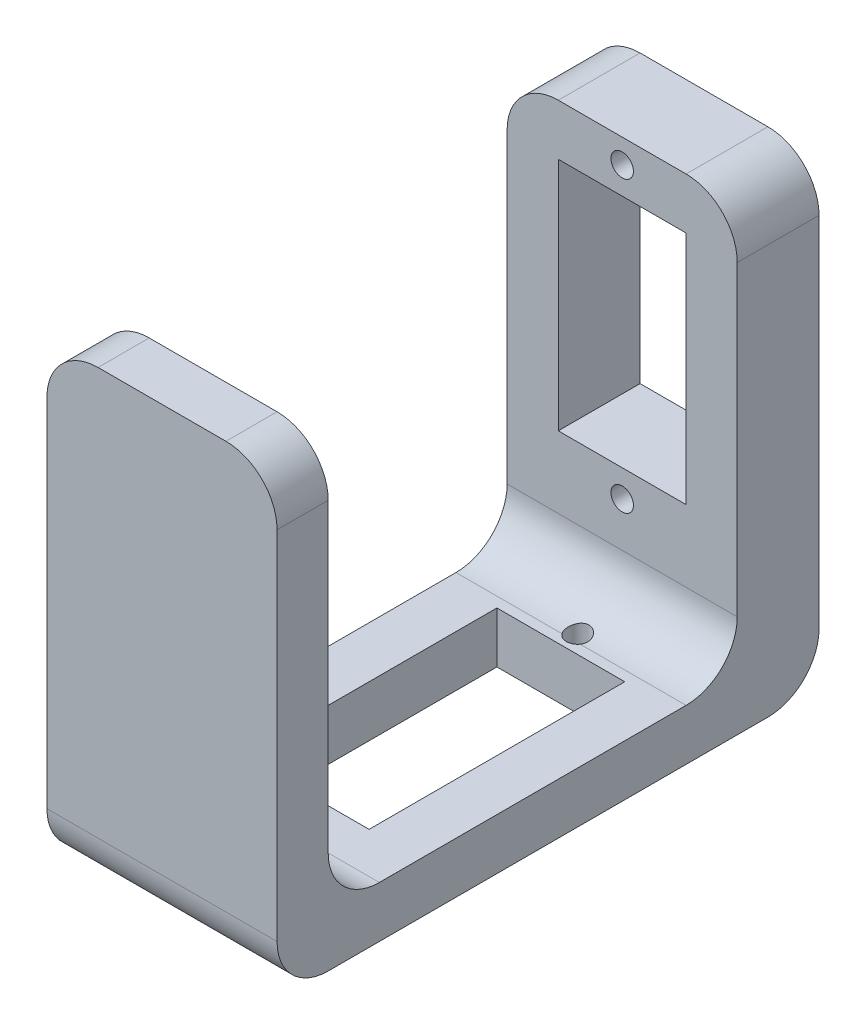
from build123d import *

# Parameters (mm, degrees)
SKETCH1_W           = 22.5
SKETCH1_H           = 33
SKETCH1_W_2         = 12.5
SKETCH1_H_2         = 23
BOSS_EXTRUDE1_DEPTH = 8
SKETCH2_R           = 1.1
CUT_EXTRUDE1_DEPTH  = 22.513077418
SKETCH4_W           = 22.5
SKETCH4_H           = 12
BOSS_EXTRUDE3_DEPTH = 8
SKETCH5_W           = 22.5
SKETCH5_H           = 5
BOSS_EXTRUDE4_DEPTH = 45
SKETCH6_W           = 12.5
SKETCH6_H           = 25
CUT_EXTRUDE2_DEPTH  = 71.431260815
SKETCH7_R           = 1.1
CUT_EXTRUDE3_DEPTH  = 65
FILLET1_R           = 5
SKETCH9_W           = 22.5
SKETCH9_H           = 44.865556073
BOSS_EXTRUDE5_DEPTH = 5
SKETCH10_R          = 8.736478528
CUT_EXTRUDE4_DEPTH  = 3
FILLET2_R           = 5
FILLET3_R           = 5
FILLET4_R           = 5


with BuildPart() as part:
    # Sketch1 → Boss-Extrude1 (new body)
    with BuildSketch(Plane.XY):
        Rectangle(SKETCH1_W, SKETCH1_H)
        Rectangle(SKETCH1_W_2, SKETCH1_H_2, mode=Mode.SUBTRACT)
    extrude(amount=BOSS_EXTRUDE1_DEPTH)

    # Sketch2 → Cut-Extrude1 (cut, through all)
    with BuildSketch(Plane.XY.offset(8)):
        with Locations((0, -14.145204103)):
            Circle(SKETCH2_R)
        with Locations((0, 14.145204103)):
            Circle(SKETCH2_R)
    extrude(amount=-CUT_EXTRUDE1_DEPTH, mode=Mode.SUBTRACT)

    # Sketch4 → Boss-Extrude3 (add)
    with BuildSketch(Plane(origin=(0, 0, 0), x_dir=(-1, 0, 0), z_dir=(0, 0, -1))):
        with Locations((0, -22.5)):
            Rectangle(SKETCH4_W, SKETCH4_H)
    extrude(amount=-BOSS_EXTRUDE3_DEPTH)

    # Sketch5 → Boss-Extrude4 (add)
    with BuildSketch(Plane.XY.offset(8)):
        with Locations((0, -26)):
            Rectangle(SKETCH5_W, SKETCH5_H)
    extrude(amount=BOSS_EXTRUDE4_DEPTH)

    # Sketch6 → Cut-Extrude2 (cut, through all)
    with BuildSketch(Plane.XZ.offset(28.5)):
        with Locations((0, 26.5)):
            Rectangle(SKETCH6_W, SKETCH6_H)
    extrude(amount=-CUT_EXTRUDE2_DEPTH, mode=Mode.SUBTRACT)

    # Sketch7 → Cut-Extrude3 (cut)
    with BuildSketch(Plane.XZ.offset(28.5)):
        with Locations(Location((0, 40.645204103, 0), (0, 0, 270))):
            Circle(SKETCH7_R)
        with Locations(Location((0, 12.354795897, 0), (0, 0, 270))):
            Circle(SKETCH7_R)
    extrude(amount=-CUT_EXTRUDE3_DEPTH, mode=Mode.SUBTRACT)

    # Fillet1
    # the kernel refuses this fillet: 5 mm, written as the material it adds along each edge
    with BuildSketch(Plane(origin=(11.25, -23.5, 8), x_dir=(0, 1, 0), z_dir=(-1, 0, 0))) as fillet1_piece_1_section:
        with BuildLine():
            CenterArc((FILLET1_R, -FILLET1_R), FILLET1_R, 90, 90)
            Line((0, -FILLET1_R), (0, 0))
            Line((0, 0), (FILLET1_R, 0))
        make_face()
    fillet1_piece_1 = extrude(amount=22.5, mode=Mode.PRIVATE)
    fillet1_piece_1 = fillet1_piece_1 - Plane(origin=(0, -22.363323705, 12.354795897), x_dir=(0, 0, -1), z_dir=(0, -1, 0)) * Cylinder(1.1, 65, mode=Mode.PRIVATE)
    add(fillet1_piece_1)

    # Sketch9 → Boss-Extrude5 (add)
    with BuildSketch(Plane.XY.offset(53)):
        with Locations((0, -6.067221963)):
            Rectangle(SKETCH9_W, SKETCH9_H)
    extrude(amount=-BOSS_EXTRUDE5_DEPTH)

    # Sketch10 → Cut-Extrude4 (cut)
    with BuildSketch(Plane(origin=(0, 0, 48), x_dir=(-1, 0, 0), z_dir=(0, 0, -1))):
        with Locations((0, 5)):
            Circle(SKETCH10_R)
    extrude(amount=-CUT_EXTRUDE4_DEPTH, mode=Mode.SUBTRACT)

    # Fillet2
    fillet2_edges = [part.edges().sort_by_distance(p)[0] for p in [
        (0, -23.5, 48),
    ]]
    fillet(fillet2_edges, radius=FILLET2_R)

    # Fillet3
    fillet3_edges = [part.edges().sort_by_distance(p)[0] for p in [
        (0, -28.5, 0),
        (0, -28.5, 53),
    ]]
    fillet(fillet3_edges, radius=FILLET3_R)

    # Fillet4
    fillet4_edges = [part.edges().sort_by_distance(p)[0] for p in [
        (11.25, 16.365556073, 50.5),
        (-11.25, 16.365556073, 50.5),
        (-11.25, 16.5, 4),
        (11.25, 16.5, 4),
    ]]
    fillet(fillet4_edges, radius=FILLET4_R)


solid = part.part
